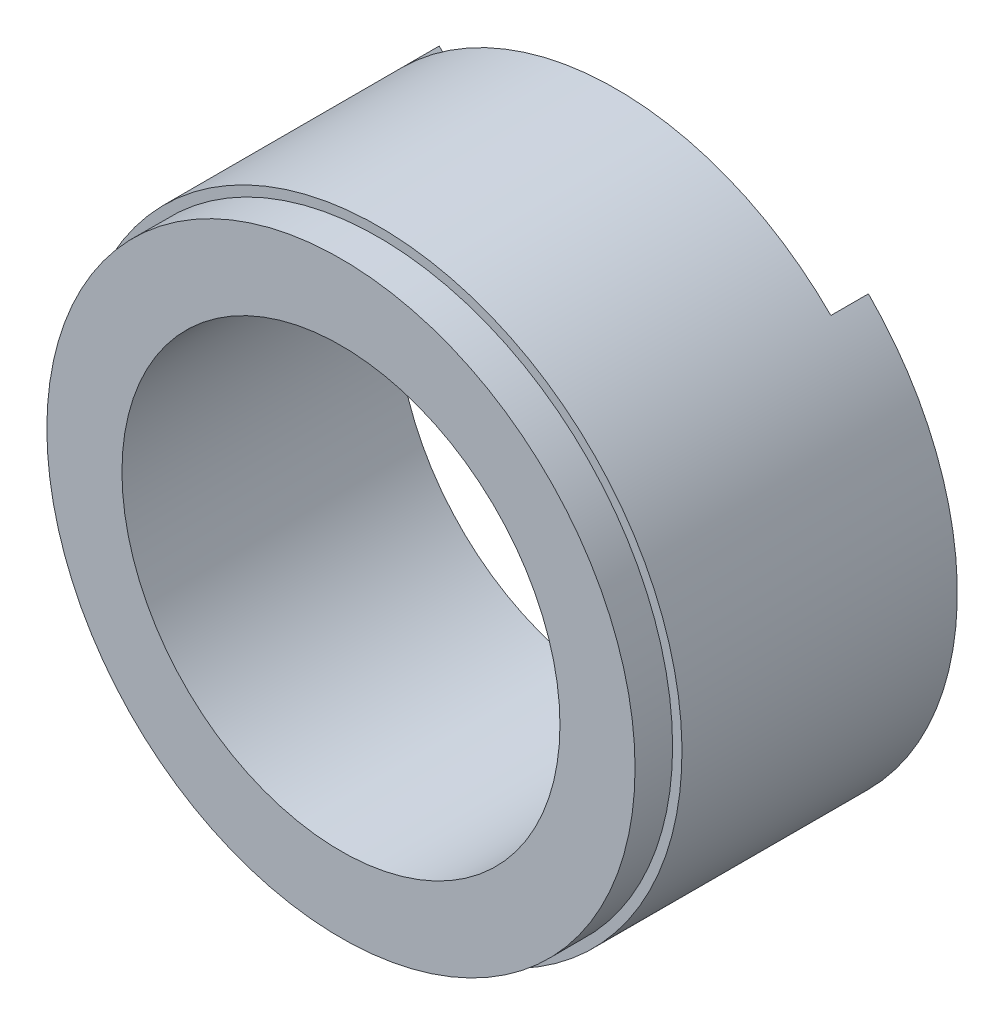
from build123d import *

# Parameters (mm, degrees)
ESQUISSE1_R             = 48.5
BOSS_EXTRU_1_DEPTH      = 44
ENL_V_START             = -6
ESQUISSE2_R             = 48.5
ESQUISSE2_R_2           = 47
ENL_V_MAT_EXTRU_1_DEPTH = 6
ESQUISSE3_R             = 35
ENL_V_MAT_EXTRU_2_DEPTH = 82.489263096
ESQUISSE5_R             = 45.5
ESQUISSE5_R_2           = 36.5
ENL_V_MAT_EXTRU_3_DEPTH = 42
ESQUISSE6_W             = 20
ESQUISSE6_H             = 4.166829754
ENL_V_MAT_EXTRU_5_DEPTH = 42
BOSS_EXTRU_2_START      = 6
BOSS_EXTRU_2_DEPTH      = 6


with BuildPart() as part:
    # Esquisse1 → Boss.-Extru.1 (new body)
    with BuildSketch(Plane.XY):
        Circle(ESQUISSE1_R)
    extrude(amount=BOSS_EXTRU_1_DEPTH)

    # Esquisse2 → Enlèv. mat.-Extru.1 (cut)
    with BuildSketch(Plane.XY.offset(44).offset(ENL_V_START)):
        Circle(ESQUISSE2_R)
        Circle(ESQUISSE2_R_2, mode=Mode.SUBTRACT)
    extrude(amount=ENL_V_MAT_EXTRU_1_DEPTH, mode=Mode.SUBTRACT)

    # Esquisse3 → Enlèv. mat.-Extru.2 (cut, through all)
    with BuildSketch(Plane.XY.offset(44)):
        Circle(ESQUISSE3_R)
    extrude(amount=-ENL_V_MAT_EXTRU_2_DEPTH, mode=Mode.SUBTRACT)

    # Esquisse5 → Enlèv. mat.-Extru.3 (cut)
    with BuildSketch(Plane(origin=(0, 0, 0), x_dir=(-1, 0, 0), z_dir=(0, 0, -1))):
        Circle(ESQUISSE5_R)
        Circle(ESQUISSE5_R_2, mode=Mode.SUBTRACT)
    extrude(amount=-ENL_V_MAT_EXTRU_3_DEPTH, mode=Mode.SUBTRACT)

    # Esquisse6 → Enlèv. mat.-Extru.5 (cut)
    with BuildSketch(Plane(origin=(0, 0, 0), x_dir=(-1, 0, 0), z_dir=(0, 0, -1))):
        with Locations((0, -46.470913117)):
            Rectangle(ESQUISSE6_W, ESQUISSE6_H)
    extrude(amount=-ENL_V_MAT_EXTRU_5_DEPTH, mode=Mode.SUBTRACT)

    # Esquisse8 → Boss.-Extru.2 (add)
    with BuildSketch(Plane(origin=(0, 0, 0), x_dir=(-1, 0, 0), z_dir=(0, 0, -1)).offset(BOSS_EXTRU_2_START)):
        with BuildLine():
            ThreePointArc((34.294678888, -34.294678888), (48.5, 0), (34.294678888, 34.294678888))
            Line((34.294678888, 34.294678888), (32.173358544, 32.173358544))
            ThreePointArc((32.173358544, 32.173358544), (45.5, 0), (32.173358544, -32.173358544))
            Line((32.173358544, -32.173358544), (34.294678888, -34.294678888))
        make_face()
        with BuildLine():
            Line((-32.173358544, 32.173358544), (-34.294678888, 34.294678888))
            ThreePointArc((-34.294678888, 34.294678888), (-48.5, 0), (-34.294678888, -34.294678888))
            Line((-34.294678888, -34.294678888), (-32.173358544, -32.173358544))
            ThreePointArc((-32.173358544, -32.173358544), (-45.5, 0), (-32.173358544, 32.173358544))
        make_face()
    extrude(amount=-BOSS_EXTRU_2_DEPTH)


solid = part.part
